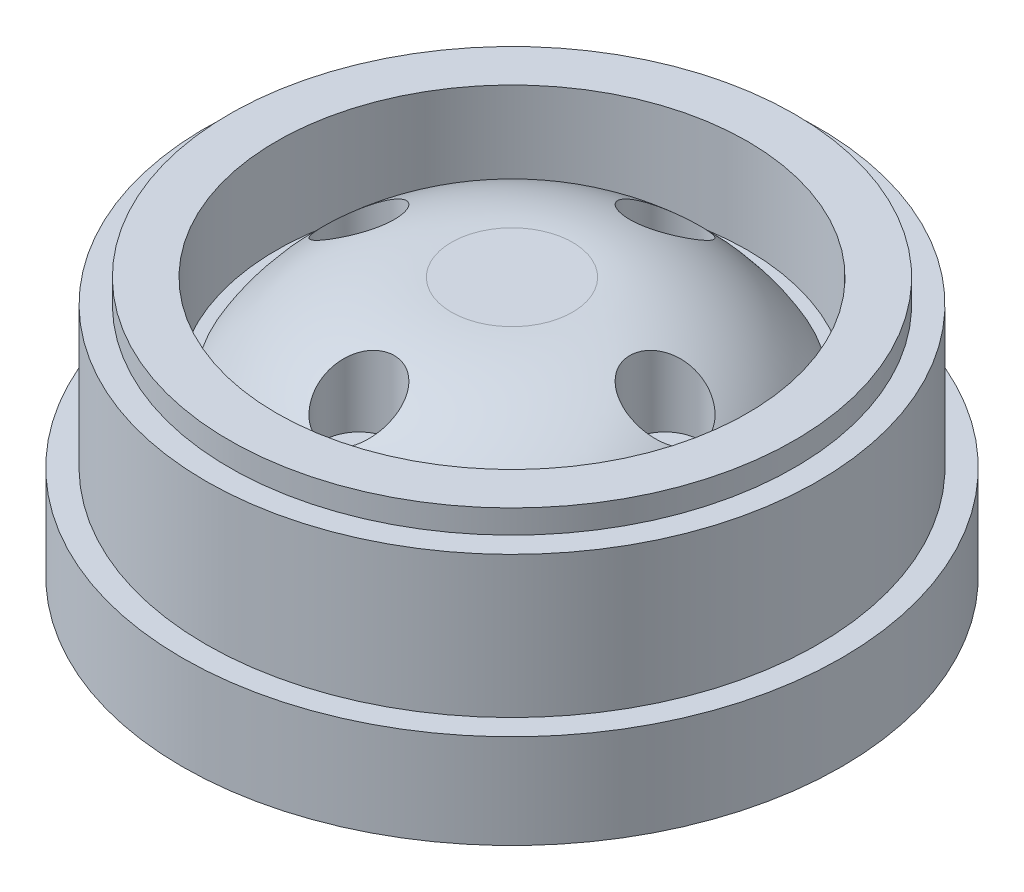
from build123d import *

# Parameters (mm, degrees)
SKETCH1_R           = 14
BOSS_EXTRUDE1_DEPTH = 4
SKETCH2_R           = 13
SKETCH2_R_2         = 12
BOSS_EXTRUDE2_DEPTH = 6
SKETCH2_3_R         = 12
SKETCH2_3_R_2       = 10
BOSS_EXTRUDE3_DEPTH = 7
SKETCH2_4_R         = 10
BOSS_EXTRUDE4_DEPTH = 3
SKETCH3_R           = 9.5
BOSS_EXTRUDE5_DEPTH = 4
FILLET1_R           = 8
SKETCH5_R           = 1.5
CUT_EXTRUDE1_DEPTH  = 3.5
SKETCH6_R           = 5.1
CUT_EXTRUDE2_DEPTH  = 4.2


with BuildPart() as part:
    # Sketch1 → Boss-Extrude1 (new body)
    with BuildSketch(Plane(origin=(0, 0, 0), x_dir=(1, 0, 0), z_dir=(0, 1, 0))):
        with Locations(Location((0, 0, 0), (0, 0, 270))):
            Circle(SKETCH1_R)
    extrude(amount=BOSS_EXTRUDE1_DEPTH)

    # Sketch2 → Boss-Extrude2 (add)
    with BuildSketch(Plane(origin=(0, 4, 0), x_dir=(1, 0, 0), z_dir=(0, 1, 0))):
        with Locations(Location((0, 0, 0), (0, 0, 270))):
            Circle(SKETCH2_R)
        with Locations(Location((0, 0, 0), (0, 0, 270))):
            Circle(SKETCH2_R_2, mode=Mode.SUBTRACT)
    extrude(amount=BOSS_EXTRUDE2_DEPTH)

    # Sketch2<3> → Boss-Extrude3 (add)
    with BuildSketch(Plane(origin=(0, 4, 0), x_dir=(1, 0, 0), z_dir=(0, 1, 0))):
        with Locations(Location((0, 0, 0), (0, 0, 90))):
            Circle(SKETCH2_3_R)
        with Locations(Location((0, 0, 0), (0, 0, 90))):
            Circle(SKETCH2_3_R_2, mode=Mode.SUBTRACT)
    extrude(amount=BOSS_EXTRUDE3_DEPTH)

    # Sketch2<4> → Boss-Extrude4 (add)
    with BuildSketch(Plane(origin=(0, 4, 0), x_dir=(1, 0, 0), z_dir=(0, 1, 0))):
        with Locations(Location((0, 0, 0), (0, 0, 90))):
            Circle(SKETCH2_4_R)
    extrude(amount=BOSS_EXTRUDE4_DEPTH)

    # Sketch3 → Boss-Extrude5 (add)
    with BuildSketch(Plane(origin=(0, 7, 0), x_dir=(1, 0, 0), z_dir=(0, 1, 0))):
        with Locations(Location((0, 0, 0), (0, 0, 270))):
            Circle(SKETCH3_R)
    extrude(amount=BOSS_EXTRUDE5_DEPTH)

    # Fillet1
    # the kernel refuses this fillet: 8 mm, written as the material it takes off along each edge
    with BuildSketch(Plane(origin=(0, 11, 0), x_dir=(0, 0, 1), z_dir=(-1, 0, 0))) as fillet1_piece_1:
        with BuildLine():
            CenterArc((2.57179677, -8), FILLET1_R, 30, 60)
            Line((2.57179677, 0), (2.57179677, 0.16))
            Line((2.57179677, 0.16), (9.5, 0.16))
            Line((9.5, 0.16), (9.66, 0))
            ThreePointArc((9.66, 0), (9.66, -2), (9.638564065, -3.92))
            Line((9.638564065, -3.92), (9.5, -4))
        make_face()
    revolve(axis=Axis((0, 11, 0), (0, 1, 0)), mode=Mode.SUBTRACT)

    # Sketch5 → Cut-Extrude1 (cut)
    with BuildSketch(Plane(origin=(0, 11, 0), x_dir=(1, 0, 0), z_dir=(0, 1, 0))):
        with Locations(Location((0, 6.5, 0), (0, 0, 270))):
            Circle(SKETCH5_R)
        with Locations(Location((6.5, 0, 0), (0, 0, 270))):
            Circle(SKETCH5_R)
        with Locations(Location((0, -6.5, 0), (0, 0, 270))):
            Circle(SKETCH5_R)
        with Locations(Location((-6.5, 0, 0), (0, 0, 270))):
            Circle(SKETCH5_R)
    extrude(amount=-CUT_EXTRUDE1_DEPTH, mode=Mode.SUBTRACT)

    # Sketch6 → Cut-Extrude2 (cut)
    with BuildSketch(Plane.XZ):
        with Locations(Location((0, 0, 0), (0, 0, 270))):
            Circle(SKETCH6_R)
    extrude(amount=-CUT_EXTRUDE2_DEPTH, mode=Mode.SUBTRACT)


solid = part.part
